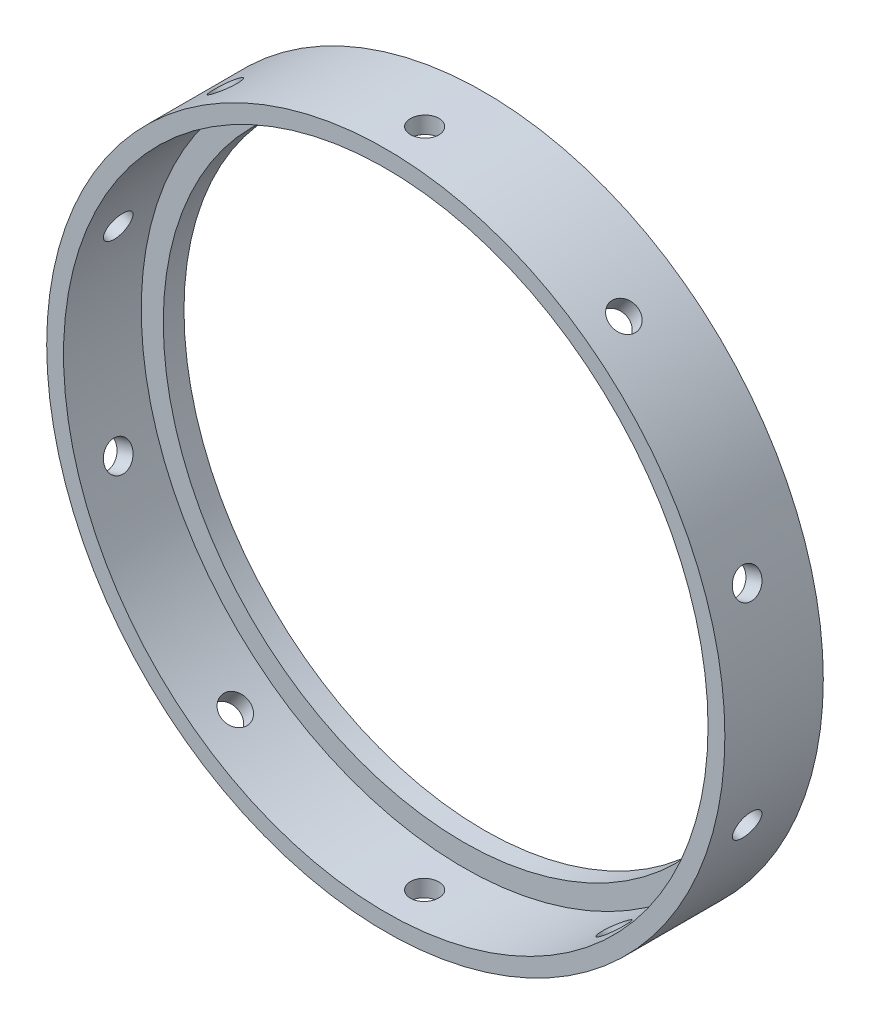
from build123d import *

# Parameters (mm, degrees)
SKETCH1_R           = 83.1215
SKETCH1_R_2         = 78.994
BOSS_EXTRUDE1_DEPTH = 19.05
SKETCH2_R           = 3.478244762
CUT_EXTRUDE1_DEPTH  = 120.085137715
CIRPATTERN1_COUNT   = 10
BOSS_EXTRUDE2_START = 5.08
SKETCH3_R           = 83.1215
SKETCH3_R_2         = 73.5965
BOSS_EXTRUDE2_DEPTH = 5.08


with BuildPart() as part:
    # Sketch1 → Boss-Extrude1 (new body)
    with BuildSketch(Plane.XY):
        Circle(SKETCH1_R)
        Circle(SKETCH1_R_2, mode=Mode.SUBTRACT)
    extrude(amount=BOSS_EXTRUDE1_DEPTH)

    # Sketch2 → Cut-Extrude1 (cut, through all)
    with BuildSketch(Plane(origin=(0, 0, 0), x_dir=(1, 0, 0), z_dir=(0, 1, 0))):
        with Locations((0, -9.525)):
            Circle(SKETCH2_R)
    cut_extrude1 = extrude(amount=-CUT_EXTRUDE1_DEPTH, mode=Mode.SUBTRACT)

    # CirPattern1: Cut-Extrude1 ×10 about axis
    cirpattern1_axis = Axis((0, 0, 2.080715754), (0, 0, 1))
    for i in range(1, CIRPATTERN1_COUNT):
        add(cut_extrude1.rotate(cirpattern1_axis, i * 360 / CIRPATTERN1_COUNT), mode=Mode.SUBTRACT)

    # Sketch3 → Boss-Extrude2 (add)
    with BuildSketch(Plane(origin=(0, 0, 0), x_dir=(-1, 0, 0), z_dir=(0, 0, -1)).offset(BOSS_EXTRUDE2_START)):
        Circle(SKETCH3_R)
        Circle(SKETCH3_R_2, mode=Mode.SUBTRACT)
    extrude(amount=-BOSS_EXTRUDE2_DEPTH)


solid = part.part
